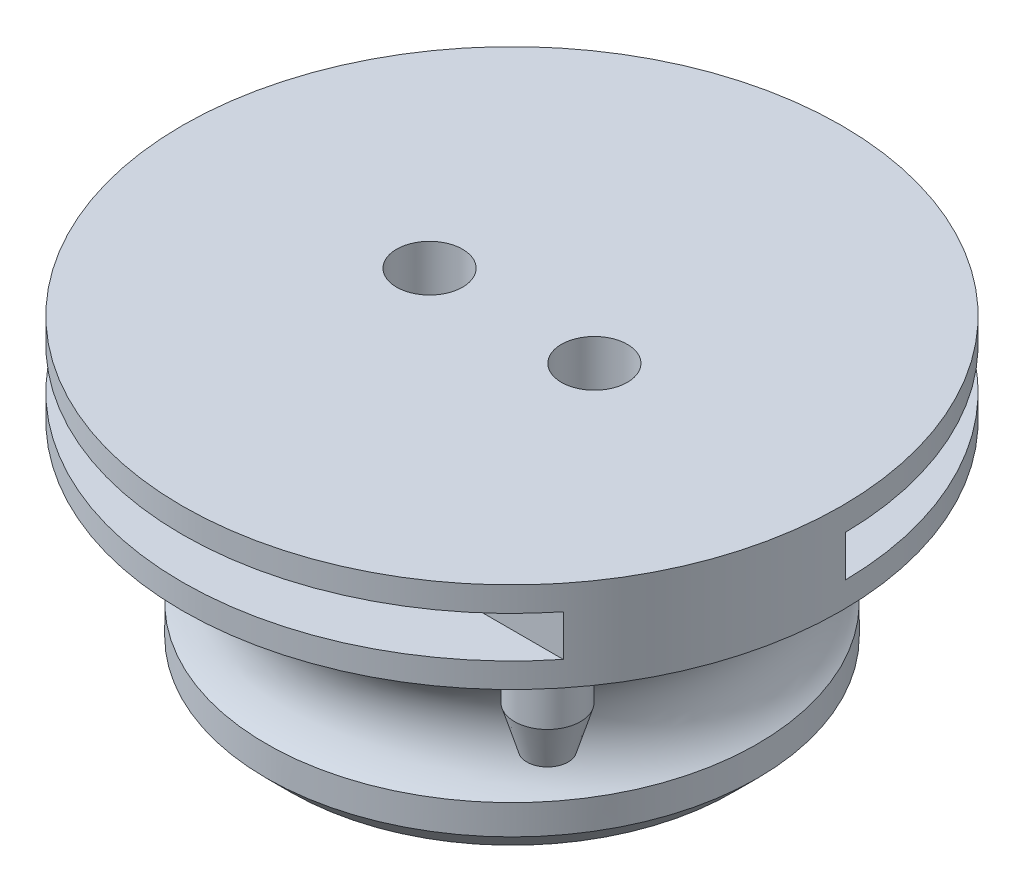
from build123d import *

# Parameters (mm, degrees)
SKETCH1_R           = 29.8
SKETCH1_R_2         = 20.2
BOSS_EXTRUDE1_DEPTH = 25.7
SKETCH3_R           = 40
BOSS_EXTRUDE2_DEPTH = 11
SKETCH4_R           = 4
BOSS_EXTRUDE3_DEPTH = 5
SKETCH6_R           = 2.5
CUT_EXTRUDE1_START  = -8
CUT_EXTRUDE1_DEPTH  = 5
CUT_EXTRUDE2_REACH  = 64.133
SKETCH8_R           = 4


with BuildPart() as part:
    # Sketch1 → Boss-Extrude1 (new body)
    with BuildSketch(Plane(origin=(0, 0, 0), x_dir=(1, 0, 0), z_dir=(0, 1, 0))):
        with Locations(Location((0, 0, 0), (0, 0, 90))):
            Circle(SKETCH1_R)
        with Locations(Location((0, 0, 0), (0, 0, 90))):
            Circle(SKETCH1_R_2, mode=Mode.SUBTRACT)
    extrude(amount=BOSS_EXTRUDE1_DEPTH)

    # Sketch2 → Cut-Revolve1 (revolve, cut)
    with BuildSketch(Plane.XY, mode=Mode.PRIVATE) as cut_revolve1_sk:
        with BuildLine():
            Line((29.8, 12.7), (29.8, 18.799180273))
            ThreePointArc((29.8, 18.799180273), (27.590586132, 16.098529094), (26.8, 12.7))
            Line((26.8, 12.7), (29.8, 12.7))
        make_face()
        with BuildLine():
            Line((29.8, 6.600819727), (29.8, 12.7))
            Line((29.8, 12.7), (26.8, 12.7))
            ThreePointArc((26.8, 12.7), (27.590586132, 9.301470906), (29.8, 6.600819727))
        make_face()
        Polygon((29.8, 3), (26.8, 0), (29.8, 0), align=None)
    revolve(cut_revolve1_sk.sketch.rotate(Axis((0, 25.7, 0), (0, -1, 0)), 270), axis=Axis((0, 25.7, 0), (0, -1, 0)), mode=Mode.SUBTRACT)

    # Sketch3 → Boss-Extrude2 (add)
    with BuildSketch(Plane(origin=(0, 25.7, 0), x_dir=(1, 0, 0), z_dir=(0, 1, 0))):
        with Locations(Location((0, 0, 0), (0, 0, 270))):
            Circle(SKETCH3_R)
    extrude(amount=BOSS_EXTRUDE2_DEPTH)

    # Sketch4 → Boss-Extrude3 (add)
    with BuildSketch(Plane(origin=(0, 25.7, 0), x_dir=(-1, 0, 0), z_dir=(0, -1, 0))):
        with Locations(Location((-26.811555509, -22.497566339, 0), (0, 0, 270))):
            Circle(SKETCH4_R)
        with Locations(Location((32.889241728, -11.970705016, 0), (0, 0, 270))):
            Circle(SKETCH4_R)
        with Locations(Location((-6.077686218, 34.468271355, 0), (0, 0, 270))):
            Circle(SKETCH4_R)
    extrude(amount=BOSS_EXTRUDE3_DEPTH)

    # Sketch6 → section 1 of loft1
    with BuildSketch(Plane(origin=(0, 15.7, 0), x_dir=(-1, 0, 0), z_dir=(0, -1, 0)), mode=Mode.PRIVATE) as loft1_s1:
        with Locations((32.889241728, -11.970705016)):
            Circle(SKETCH6_R)
    # loft from a face of the part (loft1)
    loft([part.faces().sort_by_distance((-32.889241728, 20.7, 11.970705016))[0], loft1_s1.sketch])

    # Boundary1: read off the stored shape, not the designer's step
    # Boundary1 outline → Boundary1 (revolve)
    with BuildSketch(Plane(origin=(26.811555509, 0, 22.497566339), x_dir=(1, 0, 0), z_dir=(0, 0, 1))):
        Polygon((0, 20.7), (0, 15.7), (2.5, 15.7), (4, 20.7), align=None)
    revolve(axis=Axis((26.811555509, 0, 22.497566339), (0, 1, 0)))

    # Boundary2: read off the stored shape, not the designer's step
    # Boundary2: loft between two sections, ruled curve by curve
    boundary2_from = [
        Edge.make_bspline([(9.922742778, 20.7, -33.365756026), (9.778423859, 20.7, -32.862439299), (9.289775651, 20.7, -31.913155977), (8.067478825, 20.7, -30.878607721), (6.542374051, 20.7, -30.390384874), (4.946413374, 20.7, -30.522974824), (3.522746317, 20.7, -31.256212676), (2.488002725, 20.7, -32.478460941), (1.999820352, 20.7, -34.003603594), (2.132382571, 20.7, -35.599531113), (2.865650923, 20.7, -37.023214684), (4.087837179, 20.7, -38.057933438), (5.613033755, 20.7, -38.546155237), (7.208931107, 20.7, -38.413575903), (8.632657493, 20.7, -37.680313497), (9.667322676, 20.7, -36.45811299), (10.155689167, 20.7, -34.933056337), (10.067061697, 20.7, -33.869072752), (9.922742778, 20.7, -33.365756026)], [0, 0, 0, 0, 0.0625, 0.125, 0.1875, 0.25, 0.3125, 0.375, 0.4375, 0.5, 0.5625, 0.625, 0.6875, 0.75, 0.8125, 0.875, 0.9375, 1, 1, 1, 1], 3),
    ]
    boundary2_to = [
        Edge.make_bspline([(8.313438837, 15.7, -33.349606871), (8.167005998, 15.7, -33.056947538), (7.757868808, 15.7, -32.529805617), (6.88811309, 15.7, -32.034506513), (5.895137902, 15.7, -31.909602819), (4.929849468, 15.7, -32.174234081), (4.139348951, 15.7, -32.788112293), (3.643935799, 15.7, -33.657748526), (3.519005287, 15.7, -34.650828768), (3.783658552, 15.7, -35.616093907), (4.397524642, 15.7, -36.406629525), (5.26722668, 15.7, -36.902042852), (6.260254151, 15.7, -37.026934051), (7.225507947, 15.7, -36.762316146), (8.016039922, 15.7, -36.14841822), (8.511411727, 15.7, -35.27881634), (8.63646584, 15.7, -34.285761617), (8.459871676, 15.7, -33.642266205), (8.313438837, 15.7, -33.349606871)], [0, 0, 0, 0, 0.0625, 0.125, 0.1875, 0.25, 0.3125, 0.375, 0.4375, 0.5, 0.5625, 0.625, 0.6875, 0.75, 0.8125, 0.875, 0.9375, 1, 1, 1, 1], 3),
    ]
    boundary2 = Solid(Shell([*[Face.make_surface_from_curves(boundary2_from[k], boundary2_to[k]) for k in range(1)], Face(Wire(boundary2_from)), Face(Wire(boundary2_to))]))
    add(boundary2)

    # Sketch7 → Cut-Extrude1 (cut)
    with BuildSketch(Plane(origin=(0, 36.7, 0), x_dir=(1, 0, 0), z_dir=(0, 1, 0)).offset(CUT_EXTRUDE1_START)):
        with BuildLine():
            ThreePointArc((31.224989992, 25), (0, 40), (-31.224989992, 25))
            Line((-31.224989992, 25), (0, 25))
            Line((0, 25), (31.224989992, 25))
        make_face()
        with BuildLine():
            Line((-5.8e-08, -25), (-31.224989992, -25))
            ThreePointArc((-31.224989992, -25), (0, -40), (31.224989992, -25))
            Line((31.224989992, -25), (-5.8e-08, -25))
        make_face()
        with BuildLine():
            Line((-19.515618745, -15.625), (-31.224989992, -25))
            Line((-31.224989992, -25), (-5.8e-08, -25))
            ThreePointArc((-5.8e-08, -25), (-10.825317574, -22.534695459), (-19.515618745, -15.625))
        make_face()
        with BuildLine():
            Line((-24.998227986, -0.297653397), (-39.997164778, -0.476245435))
            ThreePointArc((-39.997164778, -0.476245435), (-37.663011922, -13.472102025), (-31.224989992, -25))
            Line((-31.224989992, -25), (-19.515618745, -15.625))
            ThreePointArc((-19.515618745, -15.625), (-23.539382451, -8.420063766), (-24.998227986, -0.297653397))
        make_face()
        with BuildLine():
            ThreePointArc((39.997164778, 0.476245435), (37.663011922, 13.472102025), (31.224989992, 25))
            Line((31.224989992, 25), (19.515618745, 15.625))
            ThreePointArc((19.515618745, 15.625), (23.539382451, 8.420063766), (24.998227986, 0.297653397))
            Line((24.998227986, 0.297653397), (39.997164778, 0.476245435))
        make_face()
        with BuildLine():
            Line((31.224989992, 25), (0, 25))
            ThreePointArc((0, 25), (10.825317547, 22.534695472), (19.515618745, 15.625))
            Line((19.515618745, 15.625), (31.224989992, 25))
        make_face()
    extrude(amount=CUT_EXTRUDE1_DEPTH, mode=Mode.SUBTRACT)

    # Sketch8 → Cut-Extrude2 (cut, up to next)
    with BuildSketch(Plane(origin=(0, 25.7, 0), x_dir=(-1, 0, 0), z_dir=(0, -1, 0)), mode=Mode.PRIVATE) as cut_extrude2_sk1:
        with Locations(Location((-10, 0, 0), (0, 0, 90))):
            Circle(SKETCH8_R)
    cut_extrude2_tool1 = extrude(cut_extrude2_sk1.sketch, amount=-CUT_EXTRUDE2_REACH, mode=Mode.PRIVATE) & part.part
    # Sketch8 → Cut-Extrude2 (cut, up to next)
    with BuildSketch(Plane(origin=(0, 25.7, 0), x_dir=(-1, 0, 0), z_dir=(0, -1, 0)), mode=Mode.PRIVATE) as cut_extrude2_sk2:
        with Locations(Location((10, 0, 0), (0, 0, 90))):
            Circle(SKETCH8_R)
    cut_extrude2_tool2 = extrude(cut_extrude2_sk2.sketch, amount=-CUT_EXTRUDE2_REACH, mode=Mode.PRIVATE) & part.part
    add(cut_extrude2_tool1.solids().sort_by_distance((10, 25.7, 0))[0], mode=Mode.SUBTRACT)
    add(cut_extrude2_tool2.solids().sort_by_distance((-10, 25.7, 0))[0], mode=Mode.SUBTRACT)


solid = part.part
